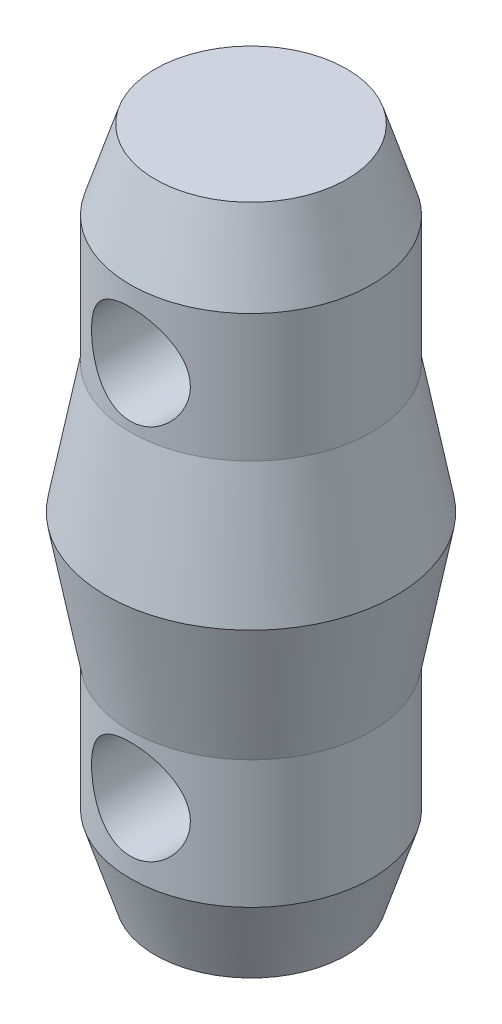
from build123d import *

# Parameters (mm, degrees)
SKETCH2_R          = 5.8928
CUT_EXTRUDE1_DEPTH = 47.926843706


with BuildPart() as part:
    # Sketch1 → Revolve1 (revolve)
    with BuildSketch(Plane.XY):
        Polygon((0, 0), (0, 40.0685), (11.4173, 40.0685), (14.3891, 30.672044722), (14.3891, 15.432044722), (17.272, 0), align=None)
    revolve1 = revolve(axis=Axis((0, 0, 0), (0, 1, 0)))

    # Sketch2 → Cut-Extrude1 (cut, symmetric)
    with BuildSketch(Plane.XY):
        with Locations((0, 22.4663)):
            Circle(SKETCH2_R)
    cut_extrude1 = extrude(amount=CUT_EXTRUDE1_DEPTH, both=True, mode=Mode.SUBTRACT)

    # Mirror1: Revolve1, Cut-Extrude1 across plane
    add(revolve1.mirror(Plane(origin=(17.272, 0, 0), x_dir=(0, 0, 1), z_dir=(0, -1, 0))))
    add(cut_extrude1.mirror(Plane(origin=(17.272, 0, 0), x_dir=(0, 0, 1), z_dir=(0, -1, 0))), mode=Mode.SUBTRACT)


solid = part.part
